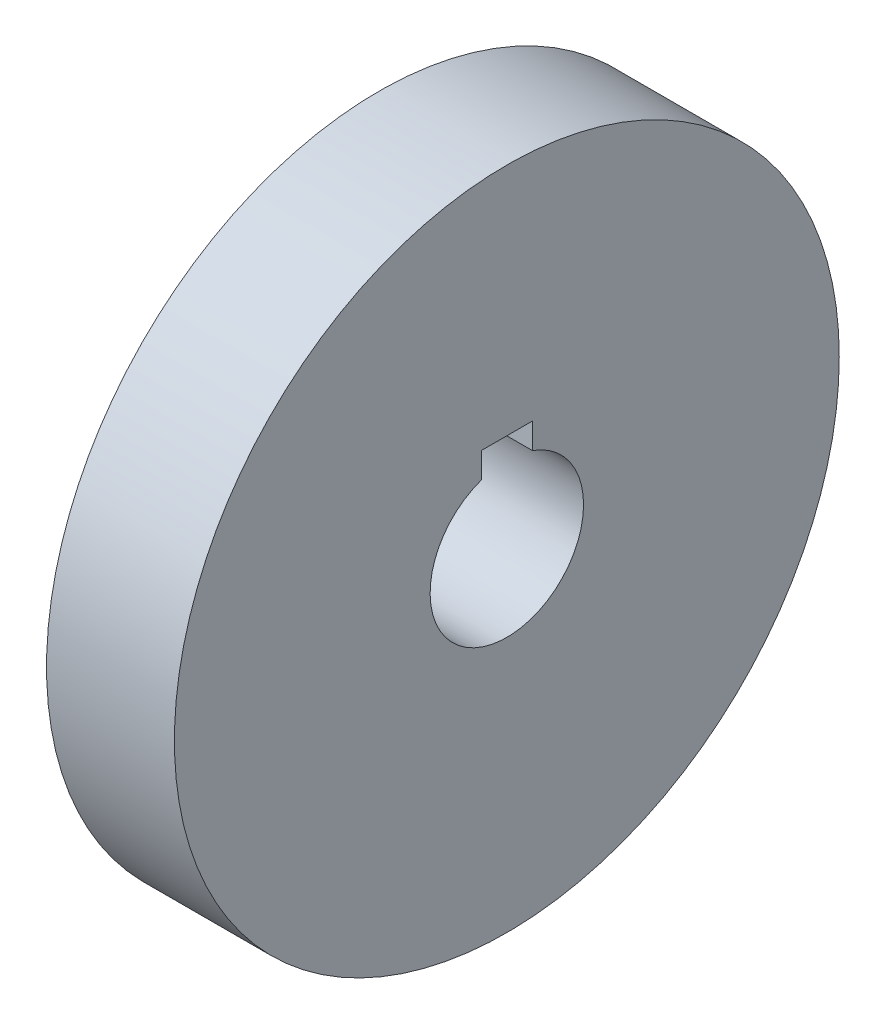
from build123d import *

# Parameters (mm, degrees)
SKETCH1_R           = 26
BOSS_EXTRUDE1_DEPTH = 10


with BuildPart() as part:
    # Sketch1 → Boss-Extrude1 (new body)
    with BuildSketch(Plane(origin=(0, 0, 0), x_dir=(0, 0, -1), z_dir=(1, 0, 0))):
        Circle(SKETCH1_R)
        with BuildLine():
            Line((2, 7.656854249), (-2, 7.656854249))
            Line((-2, 7.656854249), (-2, 5.656854249))
            ThreePointArc((-2, 5.656854249), (0, -6), (2, 5.656854249))
            Line((2, 5.656854249), (2, 7.656854249))
        make_face(mode=Mode.SUBTRACT)
    extrude(amount=BOSS_EXTRUDE1_DEPTH)


solid = part.part
